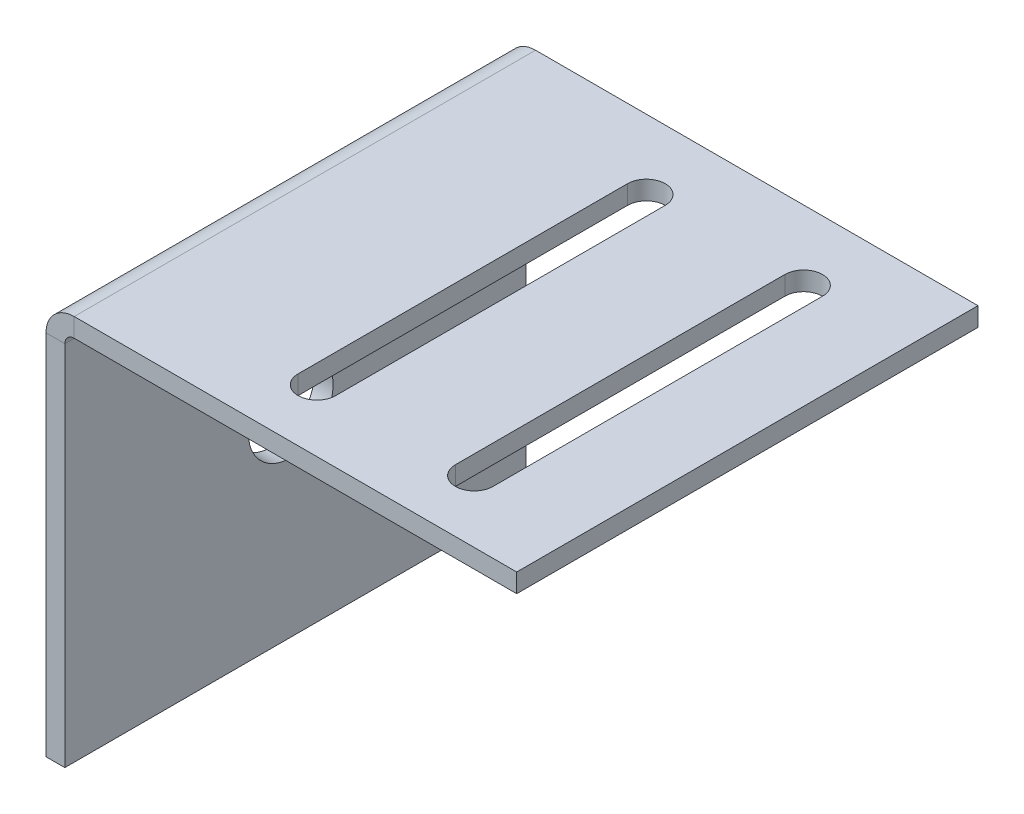
from build123d import *

# Parameters (mm, degrees)
BASE_FLANGE1_DEPTH = 49
SKETCH7_R          = 4.5
CUT_EXTRUDE1_DEPTH = 82.639451248
CUT_EXTRUDE2_DEPTH = 82.639451248


# Sheet-metal steps are written as plain solids
with BuildPart() as part:
    # Sketch1 → Base-Flange1 (new body)
    with BuildSketch(Plane.XY):
        with BuildLine():
            Line((0, 0), (0, 39))
            ThreePointArc((0, 39), (0.878679656, 41.121320344), (3, 42))
            Line((3, 42), (50, 42))
            Line((50, 42), (50, 40))
            Line((50, 40), (3, 40))
            ThreePointArc((3, 40), (2.292893219, 39.707106781), (2, 39))
            Line((2, 39), (2, 0))
            Line((2, 0), (0, 0))
        make_face()
    extrude(amount=BASE_FLANGE1_DEPTH)

    # Sketch7 → Cut-Extrude1 (cut, through all)
    with BuildSketch(Plane.ZY):
        with Locations((25, 21)):
            Circle(SKETCH7_R)
    extrude(amount=-CUT_EXTRUDE1_DEPTH, mode=Mode.SUBTRACT)

    # Sketch6 → Cut-Extrude2 (cut, through all)
    with BuildSketch(Plane(origin=(0, 42, 0), x_dir=(1, 0, 0), z_dir=(0, 1, 0))):
        with BuildLine():
            Line((40.874848709, -7.388922921), (40.874848709, -42.388922921))
            ThreePointArc((40.874848709, -42.388922921), (38.874848709, -44.388922921), (36.874848709, -42.388922921))
            Line((36.874848709, -42.388922921), (36.874848709, -7.388922921))
            ThreePointArc((36.874848709, -7.388922921), (38.874848709, -5.388922921), (40.874848709, -7.388922921))
        make_face()
        with BuildLine():
            Line((20.163393388, -7.388922921), (20.163393388, -42.388922921))
            ThreePointArc((20.163393388, -42.388922921), (22.163393388, -44.388922921), (24.163393388, -42.388922921))
            Line((24.163393388, -42.388922921), (24.163393388, -7.388922921))
            ThreePointArc((24.163393388, -7.388922921), (22.163393388, -5.388922921), (20.163393388, -7.388922921))
        make_face()
    extrude(amount=-CUT_EXTRUDE2_DEPTH, mode=Mode.SUBTRACT)


solid = part.part
